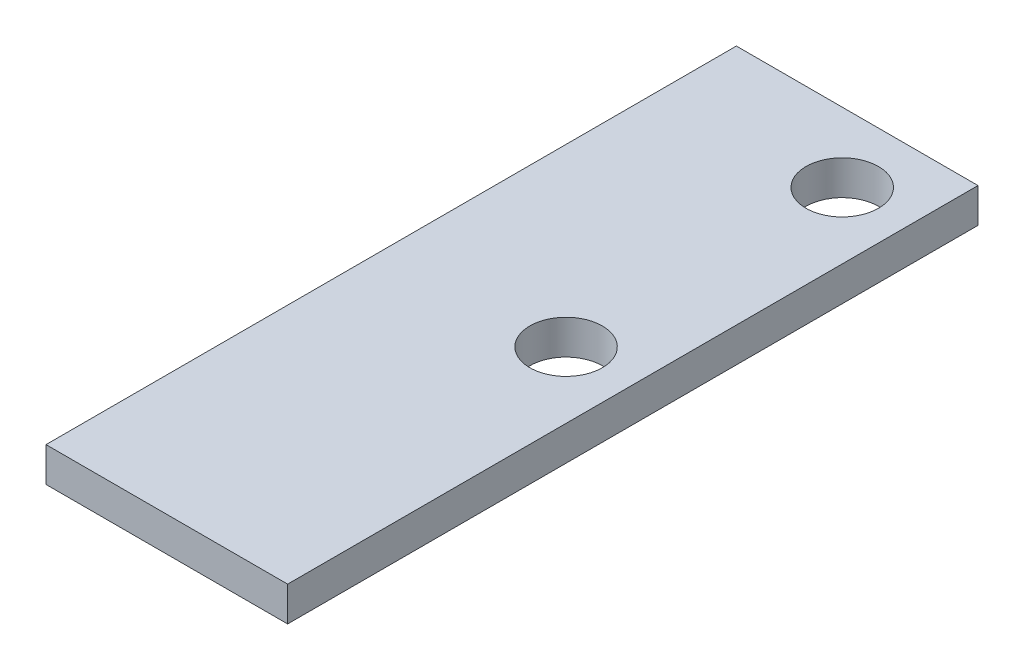
from build123d import *

# Parameters (mm, degrees)
SKETCH3_W           = 10.5
SKETCH3_H           = 30
SKETCH3_R           = 1.575
BOSS_EXTRUDE2_DEPTH = 1.5


with BuildPart() as part:
    # Sketch3 → Boss-Extrude2 (new body)
    with BuildSketch(Plane.XZ.offset(21.25)):
        with Locations((5.25, -15)):
            Rectangle(SKETCH3_W, SKETCH3_H)
        with Locations((7.62, -14.98)):
            Circle(SKETCH3_R, mode=Mode.SUBTRACT)
        with Locations((7.62, -26.98)):
            Circle(SKETCH3_R, mode=Mode.SUBTRACT)
    extrude(amount=-BOSS_EXTRUDE2_DEPTH)


solid = part.part
